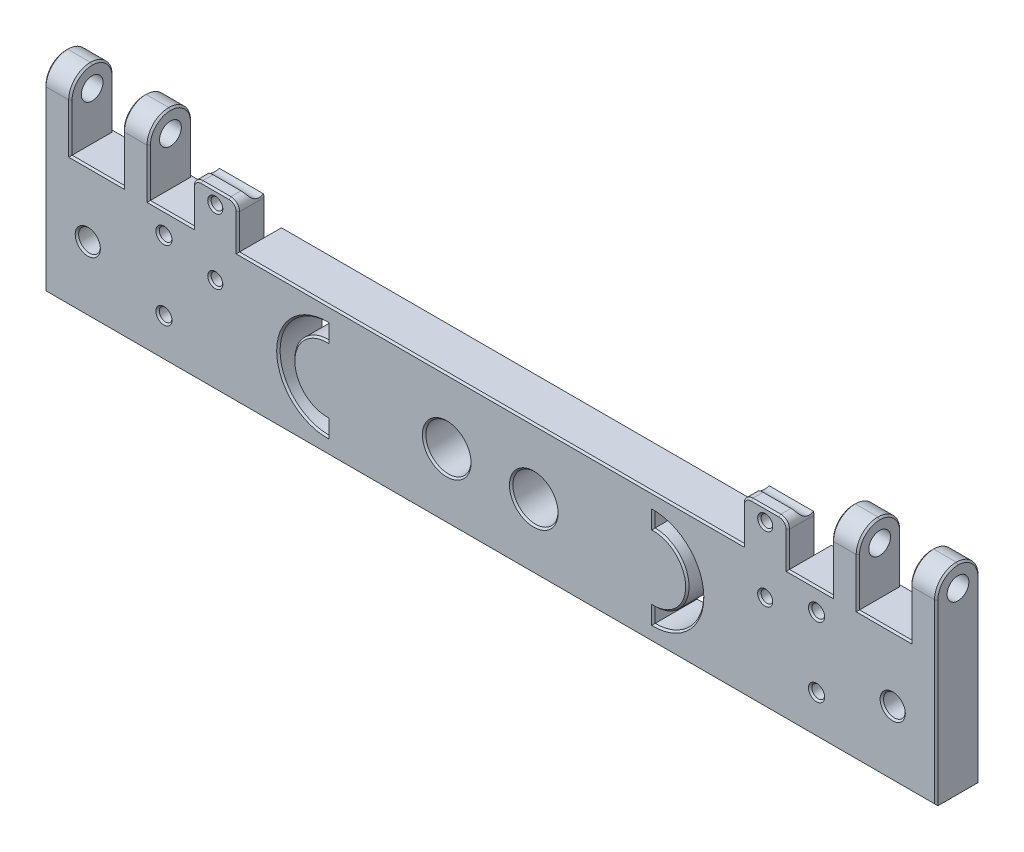
from build123d import *

# Parameters (mm, degrees)
SKETCH1_R           = 3.175
SKETCH1_R_2         = 1.7
SKETCH1_R_3         = 1.85
BOSS_EXTRUDE1_DEPTH = 12.7
SKETCH2_R           = 6.6
CUT_EXTRUDE1_DEPTH  = 5.08
FILLET1_R           = 6.35
SKETCH3_R           = 3.175
CUT_EXTRUDE2_DEPTH  = 325.374
SKETCH4_R           = 6.6
CUT_EXTRUDE3_DEPTH  = 12.7
CHAMFER1_SIZE       = 0.5


with BuildPart() as part:
    # Sketch1 → Boss-Extrude1 (new body)
    with BuildSketch(Plane.XY):
        with BuildLine():
            Line((-122.555, 19.05), (-107.315, 19.05))
            Line((-107.315, 19.05), (-107.315, 39.37))
            Line((-107.315, 39.37), (-99.695, 39.37))
            Line((-99.695, 39.37), (-99.695, 19.05))
            Line((-99.695, 19.05), (-86.868, 19.05))
            Line((-86.868, 19.05), (-86.868, 29.21))
            ThreePointArc((-86.868, 29.21), (-86.124051224, 31.006051224), (-84.328, 31.75))
            Line((-84.328, 31.75), (-76.2, 31.75))
            ThreePointArc((-76.2, 31.75), (-74.403948776, 31.006051224), (-73.66, 29.21))
            Line((-73.66, 29.21), (-73.66, 19.05))
            Line((-73.66, 19.05), (73.66, 19.05))
            Line((73.66, 19.05), (73.66, 29.21))
            ThreePointArc((73.66, 29.21), (74.403948776, 31.006051224), (76.2, 31.75))
            Line((76.2, 31.75), (84.328, 31.75))
            ThreePointArc((84.328, 31.75), (86.124051224, 31.006051224), (86.868, 29.21))
            Line((86.868, 29.21), (86.868, 19.05))
            Line((86.868, 19.05), (99.695, 19.05))
            Line((99.695, 19.05), (99.695, 39.37))
            Line((99.695, 39.37), (107.315, 39.37))
            Line((107.315, 39.37), (107.315, 19.05))
            Line((107.315, 19.05), (122.555, 19.05))
            Line((122.555, 19.05), (122.555, 39.37))
            Line((122.555, 39.37), (130.175, 39.37))
            Line((130.175, 39.37), (130.175, 19.05))
            Line((130.175, 19.05), (130.175, -19.05))
            Line((130.175, -19.05), (-130.175, -19.05))
            Line((-130.175, -19.05), (-130.175, 19.05))
            Line((-130.175, 19.05), (-130.175, 39.37))
            Line((-130.175, 39.37), (-122.555, 39.37))
            Line((-122.555, 39.37), (-122.555, 19.05))
        make_face()
        with Locations((-117.475, 0)):
            Circle(SKETCH1_R, mode=Mode.SUBTRACT)
        with Locations(Location((117.475, 0, 0), (0, 0, 180))):
            Circle(SKETCH1_R, mode=Mode.SUBTRACT)
        with Locations((-80.264, 27.94)):
            Circle(SKETCH1_R_2, mode=Mode.SUBTRACT)
        with Locations((-80.264, 8.89)):
            Circle(SKETCH1_R_2, mode=Mode.SUBTRACT)
        with Locations(Location((80.264, 8.89, 0), (0, 0, 180))):
            Circle(SKETCH1_R_2, mode=Mode.SUBTRACT)
        with Locations(Location((80.264, 27.94, 0), (0, 0, 180))):
            Circle(SKETCH1_R_2, mode=Mode.SUBTRACT)
        with Locations((-95.25, 12.7)):
            Circle(SKETCH1_R_3, mode=Mode.SUBTRACT)
        with Locations(Location((-95.25, -7.62, 0), (0, 0, 180))):
            Circle(SKETCH1_R_3, mode=Mode.SUBTRACT)
        with Locations((95.25, -7.62)):
            Circle(SKETCH1_R_3, mode=Mode.SUBTRACT)
        with Locations(Location((95.25, 12.7, 0), (0, 0, 180))):
            Circle(SKETCH1_R_3, mode=Mode.SUBTRACT)
    extrude(amount=BOSS_EXTRUDE1_DEPTH)

    # Sketch2 → Cut-Extrude1 (cut)
    with BuildSketch(Plane(origin=(0, 0, 0), x_dir=(-1, 0, 0), z_dir=(0, 0, -1))):
        with Locations((-47.625, 0)):
            Circle(SKETCH2_R)
        with Locations(Location((47.625, 0, 0), (0, 0, 180))):
            Circle(SKETCH2_R)
        with BuildLine():
            Line((-73.66, 29.21), (-73.66, 19.05))
            Line((-73.66, 19.05), (-73.66, -19.05))
            Line((-73.66, -19.05), (-86.868, -19.05))
            Line((-86.868, -19.05), (-86.868, 19.05))
            Line((-86.868, 19.05), (-86.868, 29.21))
            ThreePointArc((-86.868, 29.21), (-86.124051224, 31.006051224), (-84.328, 31.75))
            Line((-84.328, 31.75), (-76.2, 31.75))
            ThreePointArc((-76.2, 31.75), (-74.403948776, 31.006051224), (-73.66, 29.21))
        make_face()
        with BuildLine():
            Line((73.66, -19.05), (73.66, 19.05))
            Line((73.66, 19.05), (73.66, 29.21))
            ThreePointArc((73.66, 29.21), (74.403948776, 31.006051224), (76.2, 31.75))
            Line((76.2, 31.75), (84.328, 31.75))
            ThreePointArc((84.328, 31.75), (86.124051224, 31.006051224), (86.868, 29.21))
            Line((86.868, 29.21), (86.868, 19.05))
            Line((86.868, 19.05), (86.868, -19.05))
            Line((86.868, -19.05), (73.66, -19.05))
        make_face()
    extrude(amount=-CUT_EXTRUDE1_DEPTH, mode=Mode.SUBTRACT)

    # Fillet1
    fillet1_edges = [part.edges().sort_by_distance(p)[0] for p in [
        (-126.365, 39.37, 0),
        (-126.365, 39.37, 12.7),
        (-103.505, 39.37, 12.7),
        (-103.505, 39.37, 0),
        (103.505, 39.37, 0),
        (103.505, 39.37, 12.7),
        (126.365, 39.37, 12.7),
        (126.365, 39.37, 0),
    ]]
    fillet(fillet1_edges, radius=FILLET1_R - 0.0001)  # a hair under: the kernel refuses the full size

    # Sketch3 → Cut-Extrude2 (cut)
    with BuildSketch(Plane(origin=(130.175, 0, 0), x_dir=(0, 0, -1), z_dir=(1, 0, 0))):
        with Locations(Location((-6.35, 33.02, 0), (0, 0, 90))):
            Circle(SKETCH3_R)
    extrude(amount=-CUT_EXTRUDE2_DEPTH, mode=Mode.SUBTRACT)

    # Sketch4 → Cut-Extrude3 (cut)
    with BuildSketch(Plane.XY.offset(12.7)):
        with Locations((12.7, 0)):
            Circle(SKETCH4_R)
        with Locations(Location((-12.7, 0, 0), (0, 0, 180))):
            Circle(SKETCH4_R)
        with BuildLine():
            Line((47.625, 14.22), (47.625, 9.91))
            ThreePointArc((47.625, 9.91), (57.535, 0), (47.625, -9.91))
            Line((47.625, -9.91), (47.625, -14.22))
            ThreePointArc((47.625, -14.22), (61.845, 0), (47.625, 14.22))
        make_face()
        with BuildLine():
            Line((-47.625, -9.91), (-47.625, -14.22))
            ThreePointArc((-47.625, -14.22), (-61.845, 0), (-47.625, 14.22))
            Line((-47.625, 14.22), (-47.625, 9.91))
            ThreePointArc((-47.625, 9.91), (-57.535, 0), (-47.625, -9.91))
        make_face()
    extrude(amount=-CUT_EXTRUDE3_DEPTH, mode=Mode.SUBTRACT)

    # Chamfer1
    chamfer1_edges = [part.edges().sort_by_distance(p)[0] for p in [
        (-97.1, 12.7, 12.7),
        (-114.935, 19.05, 12.7),
        (93.4, -7.62, 12.7),
        (-122.555, 26.03505, 12.7),
        (97.1, 12.7, 12.7),
        (0, -19.05, 12.7),
        (-130.175, 6.98505, 0),
        (-130.175, 6.98505, 12.7),
        (-130.175, 37.51015735, 10.84015735),
        (-130.175, 37.51015735, 1.85984265),
        (-107.315, 26.03505, 0),
        (-122.555, 37.51015735, 10.84015735),
        (-122.555, 37.51015735, 1.85984265),
        (122.555, 26.03505, 12.7),
        (99.695, 26.03505, 12.7),
        (-107.315, 26.03505, 12.7),
        (-107.315, 37.51015735, 1.85984265),
        (-107.315, 37.51015735, 10.84015735),
        (-99.695, 37.51015735, 1.85984265),
        (-99.695, 37.51015735, 10.84015735),
        (114.935, 19.05, 12.7),
        (99.695, 26.03505, 0),
        (99.695, 37.51015735, 10.84015735),
        (99.695, 37.51015735, 1.85984265),
        (122.555, 26.03505, 0),
        (107.315, 37.51015735, 10.84015735),
        (107.315, 37.51015735, 1.85984265),
        (122.555, 37.51015735, 1.85984265),
        (122.555, 37.51015735, 10.84015735),
        (130.175, 37.51015735, 1.85984265),
        (130.175, 37.51015735, 10.84015735),
        (107.315, 26.03505, 12.7),
        (57.535, 0, 12.7),
        (47.625, -12.065, 12.7),
        (61.845, 0, 12.7),
        (47.625, 12.065, 12.7),
        (-57.535, 0, 12.7),
        (-47.625, 12.065, 12.7),
        (-61.845, 0, 12.7),
        (-47.625, -12.065, 12.7),
        (-6.1, 0, 12.7),
        (6.1, 0, 12.7),
        (-122.555, 26.03505, 0),
        (-99.695, 26.03505, 0),
        (93.2815, 19.05, 12.7),
        (107.315, 26.03505, 0),
        (130.175, 6.98505, 0),
        (86.868, 24.13, 12.7),
        (86.124051224, 31.006051224, 12.7),
        (80.264, 31.75, 12.7),
        (130.175, 6.98505, 12.7),
        (74.403948776, 31.006051224, 12.7),
        (73.66, 24.13, 12.7),
        (0, 19.05, 12.7),
        (-73.66, 24.13, 12.7),
        (-74.403948776, 31.006051224, 12.7),
        (-80.264, 31.75, 12.7),
        (-120.65, 0, 12.7),
        (-86.124051224, 31.006051224, 12.7),
        (120.65, 0, 12.7),
        (-86.868, 24.13, 12.7),
        (-81.964, 27.94, 12.7),
        (-93.2815, 19.05, 12.7),
        (-81.964, 8.89, 12.7),
        (81.964, 8.89, 12.7),
        (-99.695, 26.03505, 12.7),
        (81.964, 27.94, 12.7),
        (-93.4, -7.62, 12.7),
    ]]
    chamfer(chamfer1_edges, length=CHAMFER1_SIZE)


solid = part.part
